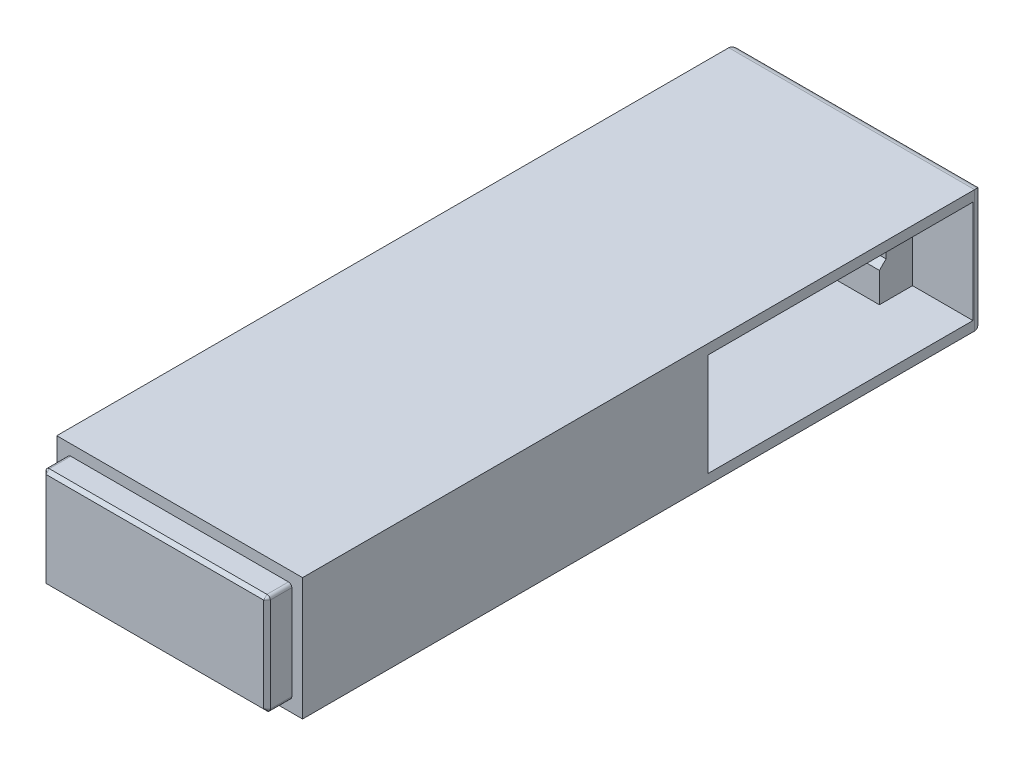
from build123d import *
from OCP.BRepFilletAPI import BRepFilletAPI_MakeChamfer

# Parameters (mm, degrees)
IZIM1_W                     = 29.7
IZIM1_H                     = 14.8
Y_KSEKLIK_EKSTR_ZYON1_DEPTH = 82.2
IZIM2_W                     = 32
IZIM2_H                     = 12.4
KES_EKSTR_ZYON1_DEPTH       = 25
Y_KSEKLIK_EKSTR_ZYON2_START = -7.3
IZIM3_W                     = 4
IZIM3_H                     = 12.4
IZIM3_R                     = 0.85
Y_KSEKLIK_EKSTR_ZYON2_DEPTH = 7
Y_KSEKLIK_EKSTR_ZYON3_START = -0.2
IZIM4_R                     = 0.85
Y_KSEKLIK_EKSTR_ZYON3_DEPTH = 0.2
PAH1_SIZE                   = 3.579571669
PAH1_SIZE_2                 = 6.2
KES_EKSTR_ZYON2_DEPTH       = 3.2
KES_EKSTR_ZYON2_DEPTH_BACK  = 85.630505729
IZIM5_W                     = 8.2
IZIM5_H                     = 4
RADYUS1_R                   = 1
IZIM7_R                     = 1.4
KES_EKSTR_ZYON3_DEPTH       = 87.235723456
IZIM8_W                     = 27.1
IZIM8_H                     = 12.2
Y_KSEKLIK_EKSTR_ZYON4_DEPTH = 3
RADYUS2_R                   = 0.4
IZIM9_W                     = 1.5
IZIM9_H                     = 4
L_O_ALTMA1_COUNT            = 2
L_O_ALTMA1_PITCH            = 35
RADYUS3_R                   = 0.5
KES_EKSTR_ZYON4_REACH       = 90.406
IZIM10_W                    = 0.8
IZIM10_H                    = 3.2
PAH3_SIZE                   = 1
PAH4_SIZE                   = 0.4
KES_EKSTR_ZYON5_DEPTH       = 3.7


# Some blends are built 0.0001 mm under size
with BuildPart() as part:
    # Çizim1 → Yükseklik-Ekstrüzyon1 (new body)
    with BuildSketch(Plane.XY):
        Rectangle(IZIM1_W, IZIM1_H)
    extrude(amount=Y_KSEKLIK_EKSTR_ZYON1_DEPTH)

    # Çizim2 → Kes-Ekstrüzyon1 (cut)
    with BuildSketch(Plane(origin=(14.85, 0, 0), x_dir=(0, 0, -1), z_dir=(1, 0, 0))):
        with Locations((-17.2, 0)):
            Rectangle(IZIM2_W, IZIM2_H)
    extrude(amount=-KES_EKSTR_ZYON1_DEPTH, mode=Mode.SUBTRACT)

    # Çizim3 → Yükseklik-Ekstrüzyon2 (add)
    # profile 1 of 2: a face of its own
    with BuildSketch(Plane(origin=(14.85, 0, 0), x_dir=(0, 0, -1), z_dir=(1, 0, 0)).offset(Y_KSEKLIK_EKSTR_ZYON2_START)):
        with Locations((-31.2, 0)):
            Rectangle(IZIM3_W, IZIM3_H)
        with Locations((-31.45, 0)):
            Circle(IZIM3_R, mode=Mode.SUBTRACT)
    # profile 2 of 2: a face of its own
    with BuildSketch(Plane(origin=(14.85, 0, 0), x_dir=(0, 0, -1), z_dir=(1, 0, 0)).offset(Y_KSEKLIK_EKSTR_ZYON2_START)):
        with Locations((-3.2, 0)):
            Rectangle(IZIM3_W, IZIM3_H)
        with Locations(Location((-2.95, 0, 0), (0, 0, 180))):
            Circle(IZIM3_R, mode=Mode.SUBTRACT)
    extrude(amount=-Y_KSEKLIK_EKSTR_ZYON2_DEPTH)

    # Çizim4 → Yükseklik-Ekstrüzyon3 (add)
    with BuildSketch(Plane.ZY.offset(-0.55).offset(Y_KSEKLIK_EKSTR_ZYON3_START)):
        with Locations(Location((31.45, 0, 0), (0, 0, 180))):
            Circle(IZIM4_R)
        with Locations((2.95, 0)):
            Circle(IZIM4_R)
    extrude(amount=Y_KSEKLIK_EKSTR_ZYON3_DEPTH)

    # Pah1
    pah1_edges_1 = [part.edges().sort_by_distance(p)[0] for p in [
        (0.55, -6.2, 3.2),
    ]]
    pah1_side_1 = [part.faces().sort_by_distance(p)[0] for p in [
        (0.478408567, -6.2, 3.2),
    ]]
    pah1_edges_2 = [part.edges().sort_by_distance(p)[0] for p in [
        (0.55, 6.2, 3.2),
    ]]
    pah1_side_2 = [part.faces().sort_by_distance(p)[0] for p in [
        (0.478408567, 6.2, 3.2),
    ]]
    pah1_edges_3 = [part.edges().sort_by_distance(p)[0] for p in [
        (0.55, -6.2, 31.2),
    ]]
    pah1_side_3 = [part.faces().sort_by_distance(p)[0] for p in [
        (0.478408567, -6.2, 31.2),
    ]]
    pah1_edges_4 = [part.edges().sort_by_distance(p)[0] for p in [
        (0.55, 6.2, 31.2),
    ]]
    pah1_side_4 = [part.faces().sort_by_distance(p)[0] for p in [
        (0.478408567, 6.2, 31.2),
    ]]
    pah1 = BRepFilletAPI_MakeChamfer(part.part.solid().wrapped)
    for e in pah1_edges_1:
        pah1.Add(PAH1_SIZE - 0.0001, PAH1_SIZE_2 - 0.0001, e.wrapped, pah1_side_1[0].wrapped)
    for e in pah1_edges_2:
        pah1.Add(PAH1_SIZE - 0.0001, PAH1_SIZE_2 - 0.0001, e.wrapped, pah1_side_2[0].wrapped)
    for e in pah1_edges_3:
        pah1.Add(PAH1_SIZE - 0.0001, PAH1_SIZE_2 - 0.0001, e.wrapped, pah1_side_3[0].wrapped)
    for e in pah1_edges_4:
        pah1.Add(PAH1_SIZE - 0.0001, PAH1_SIZE_2 - 0.0001, e.wrapped, pah1_side_4[0].wrapped)
    add(Compound.cast(pah1.Shape()), mode=Mode.REPLACE)  # a hair under: the kernel refuses the full size

    # Çizim5 → Kes-Ekstrüzyon2 (cut, two sides: drawn at the far end of the back side and taken through both)
    with BuildSketch(Plane(origin=(0, -6.2, 0), x_dir=(1, 0, 0), z_dir=(0, 1, 0)).offset(-KES_EKSTR_ZYON2_DEPTH_BACK)):
        with Locations((-6.05, -3.2)):
            Rectangle(IZIM5_W, IZIM5_H)
    extrude(amount=KES_EKSTR_ZYON2_DEPTH + KES_EKSTR_ZYON2_DEPTH_BACK, mode=Mode.SUBTRACT)

    # Radyus1
    radyus1_edges = [part.edges().sort_by_distance(p)[0] for p in [
        (0, -7.4, 0),
        (-14.85, 0, 0),
        (0, 7.4, 0),
        (14.85, 0, 0),
    ]]
    fillet(radyus1_edges, radius=RADYUS1_R)

    # Çizim7 → Kes-Ekstrüzyon3 (cut, through all)
    with BuildSketch(Plane(origin=(-10.15, 0, 0), x_dir=(0, 0, -1), z_dir=(1, 0, 0))):
        with Locations((-11, 0)):
            Circle(IZIM7_R)
    extrude(amount=-KES_EKSTR_ZYON3_DEPTH, mode=Mode.SUBTRACT)

    # Çizim8 → Yükseklik-Ekstrüzyon4 (add)
    with BuildSketch(Plane.XY.offset(82.2)):
        Rectangle(IZIM8_W, IZIM8_H)
    extrude(amount=Y_KSEKLIK_EKSTR_ZYON4_DEPTH)

    # Radyus2
    radyus2_edges = [part.edges().sort_by_distance(p)[0] for p in [
        (13.55, -6.1, 83.7),
        (13.55, 6.1, 83.7),
        (-13.55, 6.1, 83.7),
        (-13.55, -6.1, 83.7),
    ]]
    fillet(radyus2_edges, radius=RADYUS2_R)

    # Çizim9 → Kes-Döndür1 (revolve, cut)
    with BuildSketch(Plane.XZ.offset(7.4)):
        with Locations((3.25, 40)):
            Rectangle(IZIM9_W, IZIM9_H)
    kes_d_nd_r1 = revolve(axis=Axis((0, -7.4, 0), (0, 0, 1)), mode=Mode.SUBTRACT)

    # LÇoğaltma1: Kes-Döndür1 ×2
    with Locations(*[(0, 0, i * L_O_ALTMA1_PITCH) for i in range(1, L_O_ALTMA1_COUNT)]):
        add(kes_d_nd_r1, mode=Mode.SUBTRACT)

    # Radyus3
    radyus3_edges = [part.edges().sort_by_distance(p)[0] for p in [
        (2.5, -7.4, 40),
        (4, -7.4, 40),
        (-2.5, -7.4, 40),
        (-4, -7.4, 40),
        (4, -7.4, 75),
        (-4, -7.4, 75),
        (2.5, -7.4, 75),
        (-2.5, -7.4, 75),
    ]]
    fillet(radyus3_edges, radius=RADYUS3_R)

    # Çizim10 → Kes-Ekstrüzyon4 (cut, up to next)
    with BuildSketch(Plane(origin=(7.55, 0, 0), x_dir=(0, 0, -1), z_dir=(1, 0, 0)), mode=Mode.PRIVATE) as kes_ekstr_zyon4_sk1:
        with Locations((-4.8, 0)):
            Rectangle(IZIM10_W, IZIM10_H)
    kes_ekstr_zyon4_tool1 = extrude(kes_ekstr_zyon4_sk1.sketch, amount=-KES_EKSTR_ZYON4_REACH, mode=Mode.PRIVATE) & part.part
    add(kes_ekstr_zyon4_tool1.solids().sort_by_distance((7.55, 0, 4.8))[0], mode=Mode.SUBTRACT)

    # Pah3
    # the kernel refuses this chamfer: 1 mm, written as the material it takes off along each edge
    with BuildSketch(Plane(origin=(10.121682988, -1.6, 5.2), x_dir=(0, -0.9996219169112968, 0.027495876610586473), z_dir=(-1, 0, 0))) as pah3_piece_1_section:
        Polygon((PAH3_SIZE * 0.999621916911, -PAH3_SIZE * 0.0274958766106), (-PAH3_SIZE * 0.0274958766106, -PAH3_SIZE * 0.999621916911), (0, 0), align=None)
    pah3_piece_1 = extrude(amount=13.067057765, mode=Mode.PRIVATE)
    pah3_piece_1 = split(pah3_piece_1, bisect_by=Plane(origin=(3.588154105, -1.945718412, 4.4), z_dir=(0, 0, 1)), keep=Keep.TOP, mode=Mode.PRIVATE)
    add(pah3_piece_1, mode=Mode.SUBTRACT)
    with BuildSketch(Plane(origin=(10.121682988, 1.6, 5.2), x_dir=(0, 0.9996219169112968, 0.027495876610586487), z_dir=(-1, 0, 0))) as pah3_piece_2_section:
        Polygon((PAH3_SIZE * 0.999621916911, PAH3_SIZE * 0.0274958766106), (-PAH3_SIZE * 0.0274958766106, PAH3_SIZE * 0.999621916911), (0, 0), align=None)
    pah3_piece_2 = extrude(amount=13.067057765, mode=Mode.PRIVATE)
    pah3_piece_2 = split(pah3_piece_2, bisect_by=Plane(origin=(3.588154105, 1.945718412, 4.4), z_dir=(0, 0, 1)), keep=Keep.TOP, mode=Mode.PRIVATE)
    add(pah3_piece_2, mode=Mode.SUBTRACT)

    # Pah4
    pah4_edges = [part.edges().sort_by_distance(p)[0] for p in [
        (13.55, 0, 85.2),
        (0, -6.1, 85.2),
        (0, 6.1, 85.2),
        (-13.55, 0, 85.2),
        (-13.432842712, 5.982842712, 85.2),
        (13.432842712, 5.982842712, 85.2),
        (-13.432842712, -5.982842712, 85.2),
        (13.432842712, -5.982842712, 85.2),
    ]]
    chamfer(pah4_edges, length=PAH4_SIZE)

    # Çizim12 → Kes-Ekstrüzyon5 (cut)
    with BuildSketch(Plane(origin=(-10.15, 0, 0), x_dir=(0, 0, -1), z_dir=(1, 0, 0))):
        Polygon((-7.766838493, 0), (-9.383419246, 2.8), (-12.616580754, 2.8), (-14.233161507, 0), (-12.616580754, -2.8), (-9.383419246, -2.8), align=None)
    extrude(amount=-KES_EKSTR_ZYON5_DEPTH, mode=Mode.SUBTRACT)


solid = part.part
